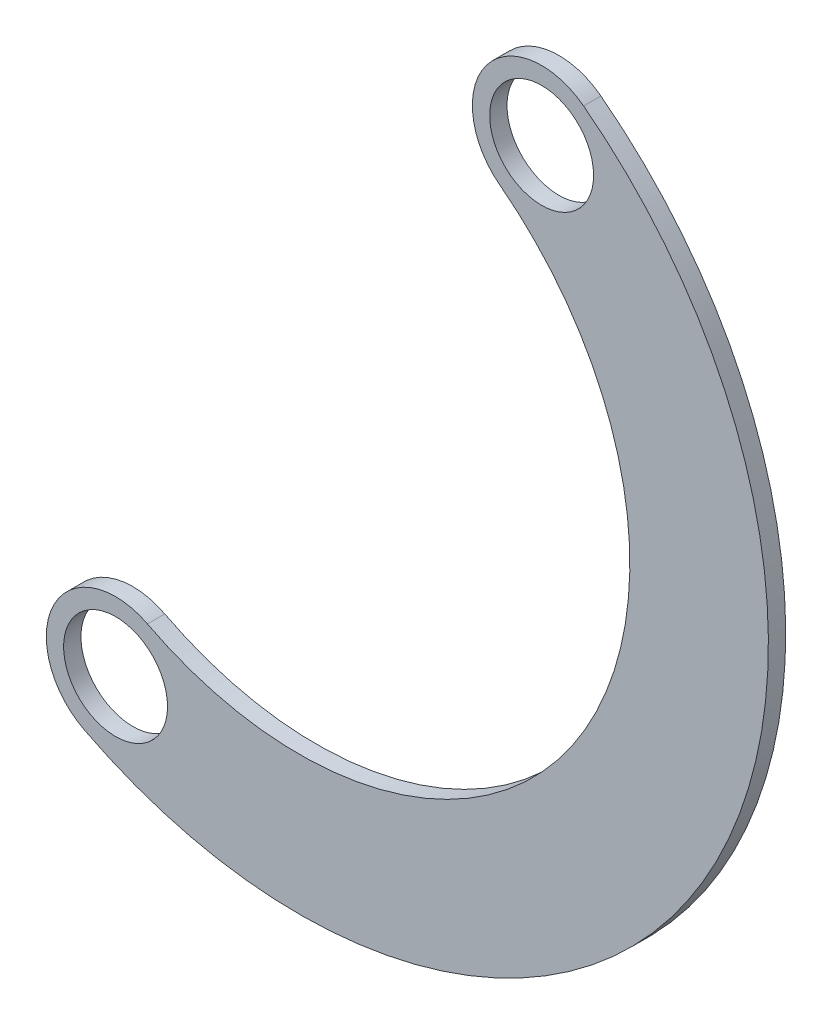
from build123d import *

# Parameters (mm, degrees)
ESQUISSE1_R               = 3
T_LE_DE_BASE_PLI_E1_DEPTH = 1


# Sheet-metal steps are written as plain solids
with BuildPart() as part:
    # Esquisse1 → Tôle de base pliée1 (new body)
    with BuildSketch(Plane.XY):
        with BuildLine():
            ThreePointArc((-33.586634848, -37.422563624), (1.75063467, -27.854557121), (-4.720147653, 8.178737781))
            ThreePointArc((-4.720147653, 8.178737781), (-10.326052384, 7.421220682), (-9.568535285, 1.815315952))
            ThreePointArc((-9.568535285, 1.815315952), (-5.008878396, -23.575657367), (-29.909395263, -30.317782906))
            ThreePointArc((-29.909395263, -30.317782906), (-35.300405414, -32.031553473), (-33.586634848, -37.422563624))
        make_face()
        with Locations((-31.748015055, -33.870173265)):
            Circle(ESQUISSE1_R, mode=Mode.SUBTRACT)
        with Locations((-7.144341469, 4.997026867)):
            Circle(ESQUISSE1_R, mode=Mode.SUBTRACT)
    extrude(amount=-T_LE_DE_BASE_PLI_E1_DEPTH)


solid = part.part
